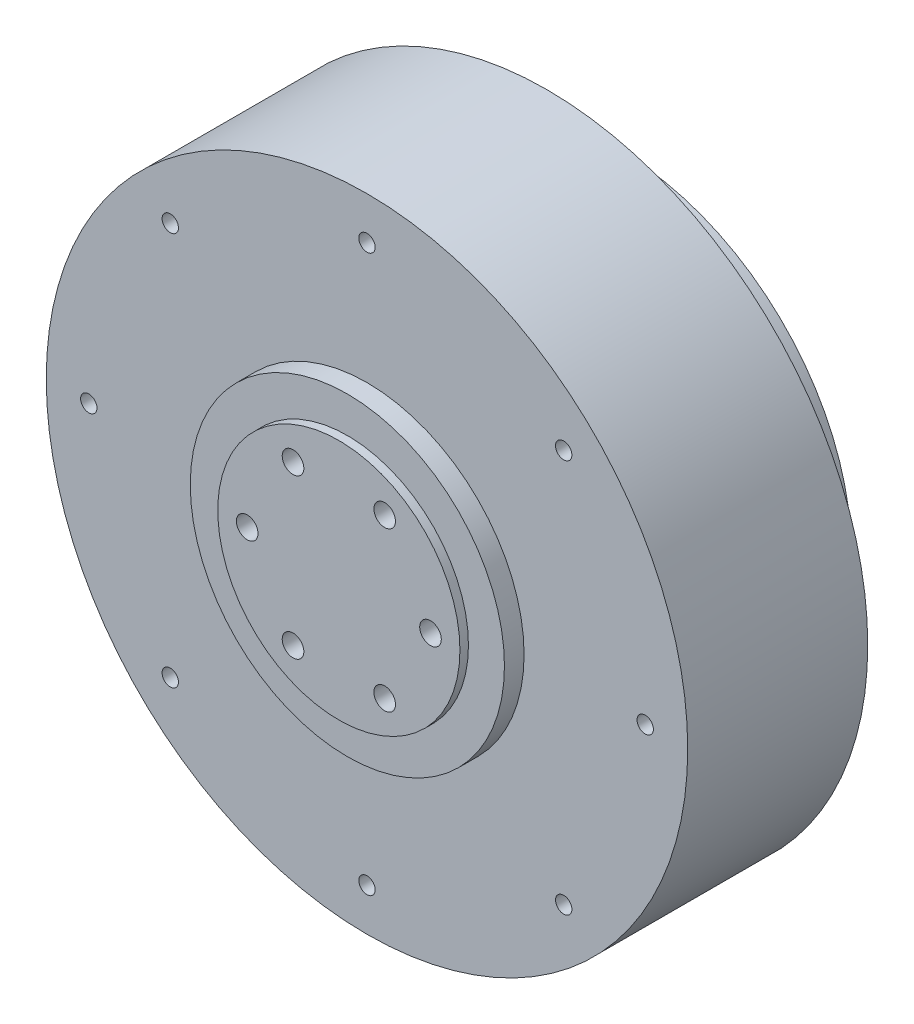
from build123d import *

# Parameters (mm, degrees)
M4_TAPPED_HOLE1_D     = 3.3
M4_TAPPED_HOLE1_DEPTH = 5
M4_TAPPED_HOLE1_TIP   = 0.991420021
M3_TAPPED_HOLE1_D     = 2.5
M3_TAPPED_HOLE1_DEPTH = 3
M3_TAPPED_HOLE1_TIP   = 0.751075774
M3_TAPPED_HOLE2_D     = 2.5
M3_TAPPED_HOLE2_DEPTH = 3
M3_TAPPED_HOLE2_TIP   = 0.751075774


with BuildPart() as part:
    # Sketch1 → Revolve1 (revolve)
    with BuildSketch(Plane(origin=(0, 0, 0), x_dir=(0, 0, -1), z_dir=(1, 0, 0))):
        Polygon((0, 0), (0, 18.5), (1.3, 18.5), (1.3, 24), (4.3, 24), (4.3, 49), (31.8, 49), (31.8, 35.5), (42.8, 35.5), (42.8, 0), align=None)
    revolve(axis=Axis((0, 0, 42.770748728), (0, 0, -1)))

    # M4 Tapped Hole1
    with Locations(Plane.XY):
        with Locations((-14, 0), (-7, 12.124355653), (7, 12.124355653), (14, 0), (7, -12.124355653), (-7, -12.124355653)):
            Hole(M4_TAPPED_HOLE1_D / 2, depth=M4_TAPPED_HOLE1_DEPTH)
            with Locations((0, 0, -(M4_TAPPED_HOLE1_DEPTH + M4_TAPPED_HOLE1_TIP / 2))):  # 118° drill point
                Cone(0, M4_TAPPED_HOLE1_D / 2, M4_TAPPED_HOLE1_TIP, mode=Mode.SUBTRACT)

    # M3 Tapped Hole1
    with Locations(Plane.XY.offset(-4.3)):
        with Locations((-42.5, 0), (-30.0520382, 30.0520382), (0, 42.5), (30.0520382, 30.0520382), (42.5, 0), (30.0520382, -30.0520382), (0, -42.5), (-30.0520382, -30.0520382)):
            Hole(M3_TAPPED_HOLE1_D / 2, depth=M3_TAPPED_HOLE1_DEPTH)
            with Locations((0, 0, -(M3_TAPPED_HOLE1_DEPTH + M3_TAPPED_HOLE1_TIP / 2))):  # 118° drill point
                Cone(0, M3_TAPPED_HOLE1_D / 2, M3_TAPPED_HOLE1_TIP, mode=Mode.SUBTRACT)

    # M3 Tapped Hole2
    with Locations(Plane(origin=(0, 0, -31.8), x_dir=(-1, 0, 0), z_dir=(0, 0, -1))):
        with Locations((-42.5, 0), (-30.0520382, 30.0520382), (0, 42.5), (30.0520382, 30.0520382), (42.5, 0), (30.0520382, -30.0520382), (0, -42.5), (-30.0520382, -30.0520382)):
            Hole(M3_TAPPED_HOLE2_D / 2, depth=M3_TAPPED_HOLE2_DEPTH)
            with Locations((0, 0, -(M3_TAPPED_HOLE2_DEPTH + M3_TAPPED_HOLE2_TIP / 2))):  # 118° drill point
                Cone(0, M3_TAPPED_HOLE2_D / 2, M3_TAPPED_HOLE2_TIP, mode=Mode.SUBTRACT)


solid = part.part
